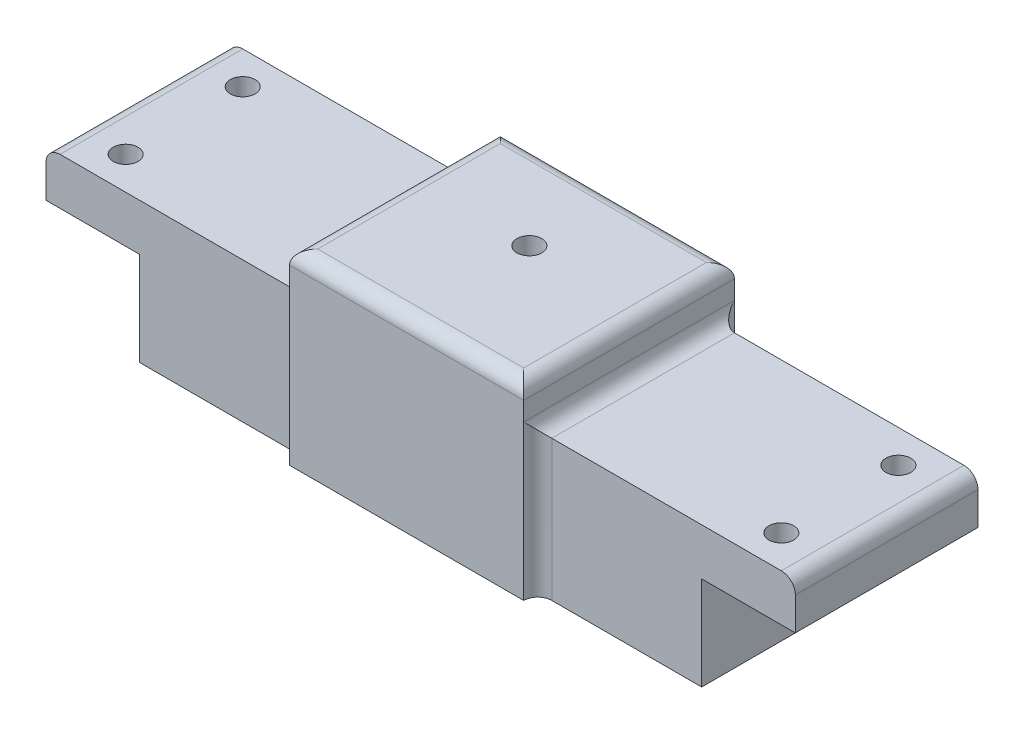
from build123d import *

# Parameters (mm, degrees)
EXTRUDE_1_DEPTH     = 45
SKETCH_2_W          = 30
SKETCH_2_H          = 35
CUT_EXTRUDE_1_DEPTH = 40.5
SKETCH_4_R          = 2.65
CUT_EXTRUDE_2_DEPTH = 40
SKETCH_5_W          = 35
SKETCH_5_H          = 29
CUT_EXTRUDE_3_DEPTH = 25
SKETCH_6_R          = 2.65
CUT_EXTRUDE_4_DEPTH = 97.566039579
SKETCH_7_W          = 55
SKETCH_7_H          = 3
CUT_EXTRUDE_5_DEPTH = 97.566039579
FILLET_1_R          = 3


with BuildPart() as part:
    # 草图1 → 凸台-拉伸1 (new body)
    with BuildSketch(Plane.XY):
        Polygon((25, 0), (-25, 0), (-25, -10), (-80, -10), (-80, -20), (-60, -20), (-60, -40), (60, -40), (60, -20), (80, -20), (80, -10), (25, -10), align=None)
    extrude(amount=EXTRUDE_1_DEPTH)

    # 草图2 → 切除-拉伸1 (cut)
    with BuildSketch(Plane(origin=(0, 0, 0), x_dir=(-1, 0, 0), z_dir=(0, 0, -1))):
        with Locations((0, -22.5)):
            Rectangle(SKETCH_2_W, SKETCH_2_H)
    extrude(amount=-CUT_EXTRUDE_1_DEPTH, mode=Mode.SUBTRACT)

    # 草图4 → 切除-拉伸2 (cut)
    with BuildSketch(Plane.XZ.offset(5)):
        with Locations((0, 18.8)):
            Circle(SKETCH_4_R)
    extrude(amount=-CUT_EXTRUDE_2_DEPTH, mode=Mode.SUBTRACT)

    # 草图5 → 切除-拉伸3 (cut)
    with BuildSketch(Plane.XZ.offset(40)):
        with Locations((-37.5, 22.5)):
            Rectangle(SKETCH_5_W, SKETCH_5_H)
        with Locations((37.5, 22.5)):
            Rectangle(SKETCH_5_W, SKETCH_5_H)
    extrude(amount=-CUT_EXTRUDE_3_DEPTH, mode=Mode.SUBTRACT)

    # 草图6 → 切除-拉伸4 (cut, through all)
    with BuildSketch(Plane(origin=(0, -10, 0), x_dir=(1, 0, 0), z_dir=(0, 1, 0))):
        with Locations(Location((70, -10, 0), (0, 0, 180))):
            Circle(SKETCH_6_R)
        with Locations(Location((70, -35, 0), (0, 0, 180))):
            Circle(SKETCH_6_R)
        with Locations(Location((-70, -35, 0), (0, 0, 180))):
            Circle(SKETCH_6_R)
        with Locations(Location((-70, -10, 0), (0, 0, 270))):
            Circle(SKETCH_6_R)
    extrude(amount=-CUT_EXTRUDE_4_DEPTH, mode=Mode.SUBTRACT)

    # 草图7 → 切除-拉伸5 (cut, through all)
    with BuildSketch(Plane(origin=(0, -10, 0), x_dir=(1, 0, 0), z_dir=(0, 1, 0))):
        with Locations((-52.5, -1.5)):
            Rectangle(SKETCH_7_W, SKETCH_7_H)
        with Locations((-52.5, -43.5)):
            Rectangle(SKETCH_7_W, SKETCH_7_H)
        with Locations((52.5, -43.5)):
            Rectangle(SKETCH_7_W, SKETCH_7_H)
        with Locations((52.5, -1.5)):
            Rectangle(SKETCH_7_W, SKETCH_7_H)
    extrude(amount=-CUT_EXTRUDE_5_DEPTH, mode=Mode.SUBTRACT)

    # 圆角1
    fillet_1_edges = [part.edges().sort_by_distance(p)[0] for p in [
        (80, -10, 22.5),
        (-80, -10, 22.5),
        (0, 0, 0),
        (-25, 0, 22.5),
        (0, 0, 45),
        (25, 0, 22.5),
        (25, -25, 42),
        (-25, -25, 42),
        (-25, -10, 22.5),
        (-25, -25, 3),
        (25, -25, 3),
        (25, -10, 22.5),
        (-37.5, -15, 37),
        (-20, -15, 22.5),
        (-37.5, -15, 8),
        (-55, -15, 22.5),
        (-55, -27.5, 37),
        (-20, -27.5, 37),
        (-20, -27.5, 8),
        (-55, -27.5, 8),
        (20, -27.5, 37),
        (37.5, -15, 37),
        (55, -27.5, 37),
        (55, -15, 22.5),
        (20, -15, 22.5),
        (20, -27.5, 8),
        (55, -27.5, 8),
        (37.5, -15, 8),
    ]]
    fillet(fillet_1_edges, radius=FILLET_1_R - 0.0001)  # a hair under: the kernel refuses the full size


solid = part.part
